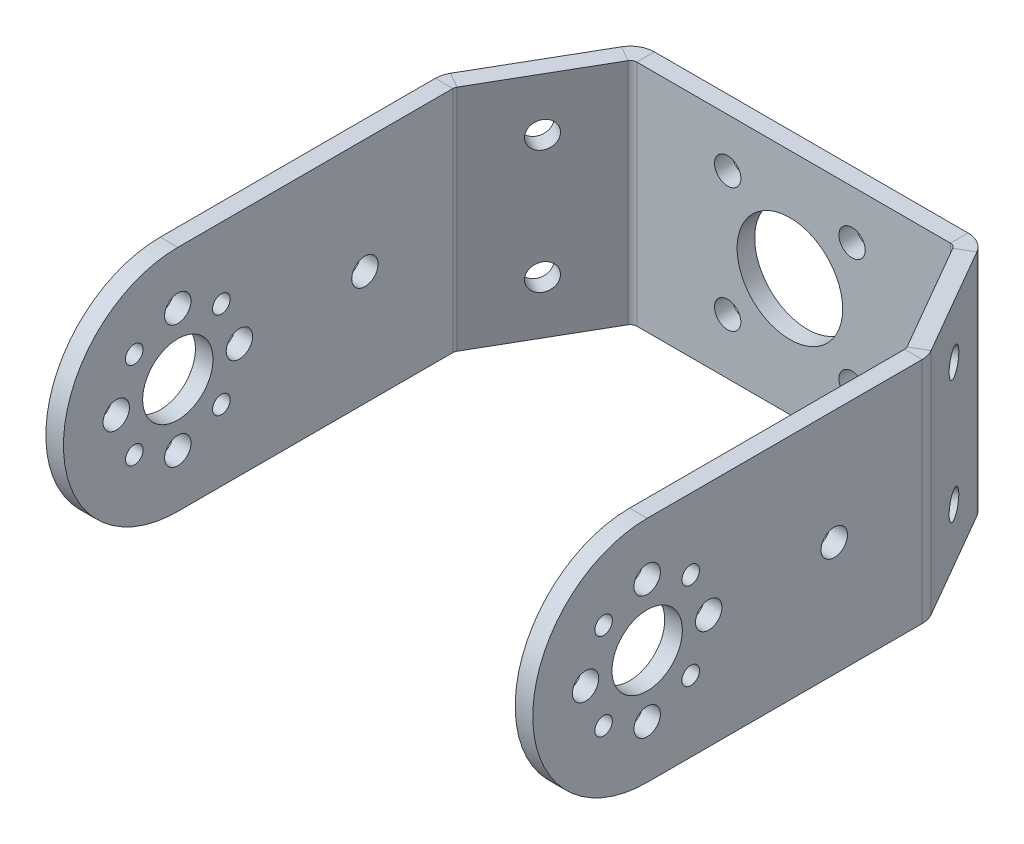
from build123d import *

# Parameters (mm, degrees)
SKETCH_1_W                       = 36.5
SKETCH_1_H                       = 26
SM_BASE_FLANGE_1_DEPTH           = 2
SM_EDGE_FLANGE_1_STRIP_CUT_DEPTH = 26
SM_EDGE_FLANGE_1_DEPTH           = 26
SM_EDGE_FLANGE_2_STRIP_CUT_DEPTH = 26
SM_EDGE_FLANGE_2_DEPTH           = 26
SM_EDGE_FLANGE_3_STRIP_CUT_DEPTH = 26
SM_EDGE_FLANGE_3_DEPTH           = 26
SM_EDGE_FLANGE_4_STRIP_CUT_DEPTH = 26
SM_EDGE_FLANGE_4_DEPTH           = 26
CUT_EXTRUDE_1_DEPTH              = 2
CUT_EXTRUDE_START                = -2
CUT_EXTRUDE_2_DEPTH              = 2
SKETCH_28_R                      = 6
SKETCH_28_R_2                    = 1.5
CUT_EXTRUDE_3_DEPTH              = 2
SKETCH_33_R                      = 4
SKETCH_33_R_2                    = 1
SKETCH_33_R_3                    = 1.5
CUT_EXTRUDE_4_DEPTH              = 2
SKETCH_34_R                      = 1
SKETCH_34_R_2                    = 1.5
SKETCH_34_R_3                    = 4
CUT_EXTRUDE_5_DEPTH              = 2
SKETCH_35_R                      = 1.5
CUT_EXTRUDE_6_DEPTH              = 2
SKETCH_36_R                      = 1.5
CUT_EXTRUDE_7_DEPTH              = 2
SKETCH_37_R                      = 1.5
CUT_EXTRUDE_8_DEPTH              = 100


# Sheet-metal steps are written as plain solids
with BuildPart() as part:
    # Sketch 1 → 基体-法兰1 (new body)
    with BuildSketch(Plane.XY):
        with Locations((0.504940711, 5.522068511)):
            Rectangle(SKETCH_1_W, SKETCH_1_H)
    extrude(amount=-SM_BASE_FLANGE_1_DEPTH)

    # 边线-法兰1 strip (across the edge) → 边线-法兰1 strip cut (cut)
    with BuildSketch(Plane(origin=(18.754940711, -7.477931489, 0), x_dir=(-0.8660254037844364, 0, 0.5000000000000041), z_dir=(0, 1, 0))):
        Polygon((-8.835731855, 2.791911088), (-0.6317, -1.944688912), (0.3683, -0.212638104), (-7.835731855, 4.523961896), align=None)
    extrude(amount=SM_EDGE_FLANGE_1_STRIP_CUT_DEPTH, mode=Mode.SUBTRACT)

    # 边线-法兰1 section (across the edge) → 边线-法兰1 (add)
    with BuildSketch(Plane(origin=(18.754940711, -7.477931489, 0), x_dir=(-0.8660254037844364, 0, 0.5000000000000041), z_dir=(0, 1, 0))):
        with BuildLine():
            Line((-2, 0.425276208), (-2, 14.845299462))
            Line((-2, 14.845299462), (0, 14.845299462))
            Line((0, 14.845299462), (0, 0.425276208))
            ThreePointArc((0, 0.425276208), (0.098685688, 0.056976208), (0.3683, -0.212638104))
            Line((0.3683, -0.212638104), (-0.6317, -1.944688912))
            ThreePointArc((-0.6317, -1.944688912), (-1.63336512, -0.943023792), (-2, 0.425276208))
        make_face()
    extrude(amount=SM_EDGE_FLANGE_1_DEPTH)

    # 边线-法兰2 strip (across the edge) → 边线-法兰2 strip cut (cut)
    with BuildSketch(Plane(origin=(26.177590442, -7.477931489, 12.856406461), x_dir=(-1, 0, 0), z_dir=(0, 1, 0))):
        Polygon((-6.36996512, 7.03310323), (-1.63336512, -1.170928625), (0.098685688, -0.170928625), (-4.637914312, 8.03310323), align=None)
    extrude(amount=SM_EDGE_FLANGE_2_STRIP_CUT_DEPTH, mode=Mode.SUBTRACT)

    # 边线-法兰2 section (across the edge) → 边线-法兰2 (add)
    with BuildSketch(Plane(origin=(26.177590442, -7.477931489, 12.856406461), x_dir=(-1, 0, 0), z_dir=(0, 1, 0))):
        with BuildLine():
            Line((-2, 0.197371375), (-2, 44.464101615))
            Line((-2, 44.464101615), (0, 44.464101615))
            Line((0, 44.464101615), (0, 0.197371375))
            ThreePointArc((0, 0.197371375), (0.025099036, 0.006725267), (0.098685688, -0.170928625))
            Line((0.098685688, -0.170928625), (-1.63336512, -1.170928625))
            ThreePointArc((-1.63336512, -1.170928625), (-1.906752616, -0.510912824), (-2, 0.197371375))
        make_face()
    extrude(amount=SM_EDGE_FLANGE_2_DEPTH)

    # 边线-法兰3 strip (across the edge) → 边线-法兰3 strip cut (cut)
    with BuildSketch(Plane(origin=(-17.745059289, 18.522068511, 0), x_dir=(0.8660254037844365, 0, 0.500000000000004), z_dir=(0, -1, 0))):
        Polygon((-8.835731855, 2.791911088), (-0.6317, -1.944688912), (0.3683, -0.212638104), (-7.835731855, 4.523961896), align=None)
    extrude(amount=SM_EDGE_FLANGE_3_STRIP_CUT_DEPTH, mode=Mode.SUBTRACT)

    # 边线-法兰3 section (across the edge) → 边线-法兰3 (add)
    with BuildSketch(Plane(origin=(-17.745059289, 18.522068511, 0), x_dir=(0.8660254037844365, 0, 0.500000000000004), z_dir=(0, -1, 0))):
        with BuildLine():
            Line((-2, 0.425276208), (-2, 14.845299462))
            Line((-2, 14.845299462), (0, 14.845299462))
            Line((0, 14.845299462), (0, 0.425276208))
            ThreePointArc((0, 0.425276208), (0.098685688, 0.056976208), (0.3683, -0.212638104))
            Line((0.3683, -0.212638104), (-0.6317, -1.944688912))
            ThreePointArc((-0.6317, -1.944688912), (-1.63336512, -0.943023792), (-2, 0.425276208))
        make_face()
    extrude(amount=SM_EDGE_FLANGE_3_DEPTH)

    # 边线-法兰4 strip (across the edge) → 边线-法兰4 strip cut (cut)
    with BuildSketch(Plane(origin=(-25.167709019, 18.522068511, 12.856406461), x_dir=(1, 0, 0), z_dir=(0, -1, 0))):
        Polygon((-6.36996512, 7.03310323), (-1.63336512, -1.170928625), (0.098685688, -0.170928625), (-4.637914312, 8.03310323), align=None)
    extrude(amount=SM_EDGE_FLANGE_4_STRIP_CUT_DEPTH, mode=Mode.SUBTRACT)

    # 边线-法兰4 section (across the edge) → 边线-法兰4 (add)
    with BuildSketch(Plane(origin=(-25.167709019, 18.522068511, 12.856406461), x_dir=(1, 0, 0), z_dir=(0, -1, 0))):
        with BuildLine():
            Line((-2, 0.197371375), (-2, 44.464101615))
            Line((-2, 44.464101615), (0, 44.464101615))
            Line((0, 44.464101615), (0, 0.197371375))
            ThreePointArc((0, 0.197371375), (0.025099036, 0.006725267), (0.098685688, -0.170928625))
            Line((0.098685688, -0.170928625), (-1.63336512, -1.170928625))
            ThreePointArc((-1.63336512, -1.170928625), (-1.906752616, -0.510912824), (-2, 0.197371375))
        make_face()
    extrude(amount=SM_EDGE_FLANGE_4_DEPTH)

    # 草图20 → 切除-拉伸1 (cut)
    with BuildSketch(Plane.ZY.offset(-26.177590442)):
        with BuildLine():
            ThreePointArc((44.320508076, 18.522068511), (53.512896231, 14.714456667), (57.320508076, 5.522068511))
            Line((57.320508076, 5.522068511), (57.320508076, 18.522068511))
            Line((57.320508076, 18.522068511), (44.320508076, 18.522068511))
        make_face()
        with BuildLine():
            Line((57.320508076, -7.477931489), (57.320508076, 5.522068511))
            ThreePointArc((57.320508076, 5.522068511), (53.512896231, -3.670319644), (44.320508076, -7.477931489))
            Line((44.320508076, -7.477931489), (57.320508076, -7.477931489))
        make_face()
    extrude(amount=-CUT_EXTRUDE_1_DEPTH, mode=Mode.SUBTRACT)

    # 草图21 → 切除-拉伸2 (cut)
    with BuildSketch(Plane(origin=(-25.167709019, 0, 0), x_dir=(0, 0, -1), z_dir=(1, 0, 0)).offset(CUT_EXTRUDE_START)):
        with BuildLine():
            Line((-57.320508076, -7.477931489), (-44.320508076, -7.477931489))
            ThreePointArc((-44.320508076, -7.477931489), (-53.512896231, -3.670319644), (-57.320508076, 5.522068511))
            Line((-57.320508076, 5.522068511), (-57.320508076, -7.477931489))
        make_face()
        with BuildLine():
            ThreePointArc((-57.320508076, 5.522068511), (-53.512896231, 14.714456667), (-44.320508076, 18.522068511))
            Line((-44.320508076, 18.522068511), (-57.320508076, 18.522068511))
            Line((-57.320508076, 18.522068511), (-57.320508076, 5.522068511))
        make_face()
    extrude(amount=CUT_EXTRUDE_2_DEPTH, mode=Mode.SUBTRACT)

    # 草图28 → 切除-拉伸3 (cut)
    with BuildSketch(Plane.XY):
        with Locations((0.077660184, 5.906325961)):
            Circle(SKETCH_28_R)
        with Locations((7.148727996, 12.977393772)):
            Circle(SKETCH_28_R_2)
        with Locations((-6.993407628, -1.164741851)):
            Circle(SKETCH_28_R_2)
        with Locations((-6.993407628, 12.977393772)):
            Circle(SKETCH_28_R_2)
        with Locations((7.148727996, -1.164741851)):
            Circle(SKETCH_28_R_2)
    extrude(amount=-CUT_EXTRUDE_3_DEPTH, mode=Mode.SUBTRACT)

    # 草图33 → 切除-拉伸4 (cut)
    with BuildSketch(Plane(origin=(28.177590442, 0, 0), x_dir=(0, 0, -1), z_dir=(1, 0, 0))):
        with Locations((-44.320508076, 5.522068511)):
            Circle(SKETCH_33_R)
        with Locations((-39.370760607, 10.47181598)):
            Circle(SKETCH_33_R_2)
        with Locations((-39.370760607, 0.572321043)):
            Circle(SKETCH_33_R_2)
        with Locations((-49.270255544, 0.572321043)):
            Circle(SKETCH_33_R_2)
        with Locations((-49.270255544, 10.47181598)):
            Circle(SKETCH_33_R_2)
        with Locations((-44.320508076, 12.522068511)):
            Circle(SKETCH_33_R_3)
        with Locations((-37.320508076, 5.522068511)):
            Circle(SKETCH_33_R_3)
        with Locations((-44.320508076, -1.477931489)):
            Circle(SKETCH_33_R_3)
        with Locations((-51.320508076, 5.522068511)):
            Circle(SKETCH_33_R_3)
    extrude(amount=-CUT_EXTRUDE_4_DEPTH, mode=Mode.SUBTRACT)

    # 草图34 → 切除-拉伸5 (cut)
    with BuildSketch(Plane.ZY.offset(27.167709019).offset(CUT_EXTRUDE_START)):
        with Locations(Location((49.270255544, 10.47181598, 0), (0, 0, 180))):
            Circle(SKETCH_34_R)
        with Locations(Location((51.320508076, 5.522068511, 0), (0, 0, 180))):
            Circle(SKETCH_34_R_2)
        with Locations(Location((49.270255544, 0.572321043, 0), (0, 0, 180))):
            Circle(SKETCH_34_R)
        with Locations(Location((44.320508076, -1.477931489, 0), (0, 0, 180))):
            Circle(SKETCH_34_R_2)
        with Locations(Location((39.370760607, 0.572321043, 0), (0, 0, 180))):
            Circle(SKETCH_34_R)
        with Locations(Location((37.320508076, 5.522068511, 0), (0, 0, 180))):
            Circle(SKETCH_34_R_2)
        with Locations(Location((39.370760607, 10.47181598, 0), (0, 0, 180))):
            Circle(SKETCH_34_R)
        with Locations(Location((44.320508076, 12.522068511, 0), (0, 0, 180))):
            Circle(SKETCH_34_R_2)
        with Locations(Location((44.320508076, 5.522068511, 0), (0, 0, 180))):
            Circle(SKETCH_34_R_3)
    extrude(amount=CUT_EXTRUDE_5_DEPTH, mode=Mode.SUBTRACT)

    # 草图35 → 切除-拉伸6 (cut)
    with BuildSketch(Plane(origin=(15.798256341, 0, -9.121127551), x_dir=(-0.5000000000000041, 0, -0.8660254037844364), z_dir=(0.8660254037844363, 0, -0.500000000000004))):
        with Locations((-16.914072503, -1.477931489)):
            Circle(SKETCH_35_R)
        with Locations((-16.914072503, 12.522068511)):
            Circle(SKETCH_35_R)
    extrude(amount=-CUT_EXTRUDE_6_DEPTH, mode=Mode.SUBTRACT)

    # 草图36 → 切除-拉伸7 (cut)
    with BuildSketch(Plane(origin=(-15.040845274, 0, -8.683836068), x_dir=(-0.5000000000000041, 0, 0.8660254037844364), z_dir=(-0.8660254037844363, 0, -0.500000000000004))):
        with Locations((16.409131792, 12.522068511)):
            Circle(SKETCH_36_R)
        with Locations((16.409131792, -1.477931489)):
            Circle(SKETCH_36_R)
    extrude(amount=-CUT_EXTRUDE_7_DEPTH, mode=Mode.SUBTRACT)

    # 草图37 → 切除-拉伸8 (cut)
    with BuildSketch(Plane(origin=(28.177590442, 0, 0), x_dir=(0, 0, -1), z_dir=(1, 0, 0))):
        with Locations((-23.053777836, 5.522068511)):
            Circle(SKETCH_37_R)
    extrude(amount=-CUT_EXTRUDE_8_DEPTH, mode=Mode.SUBTRACT)


solid = part.part
